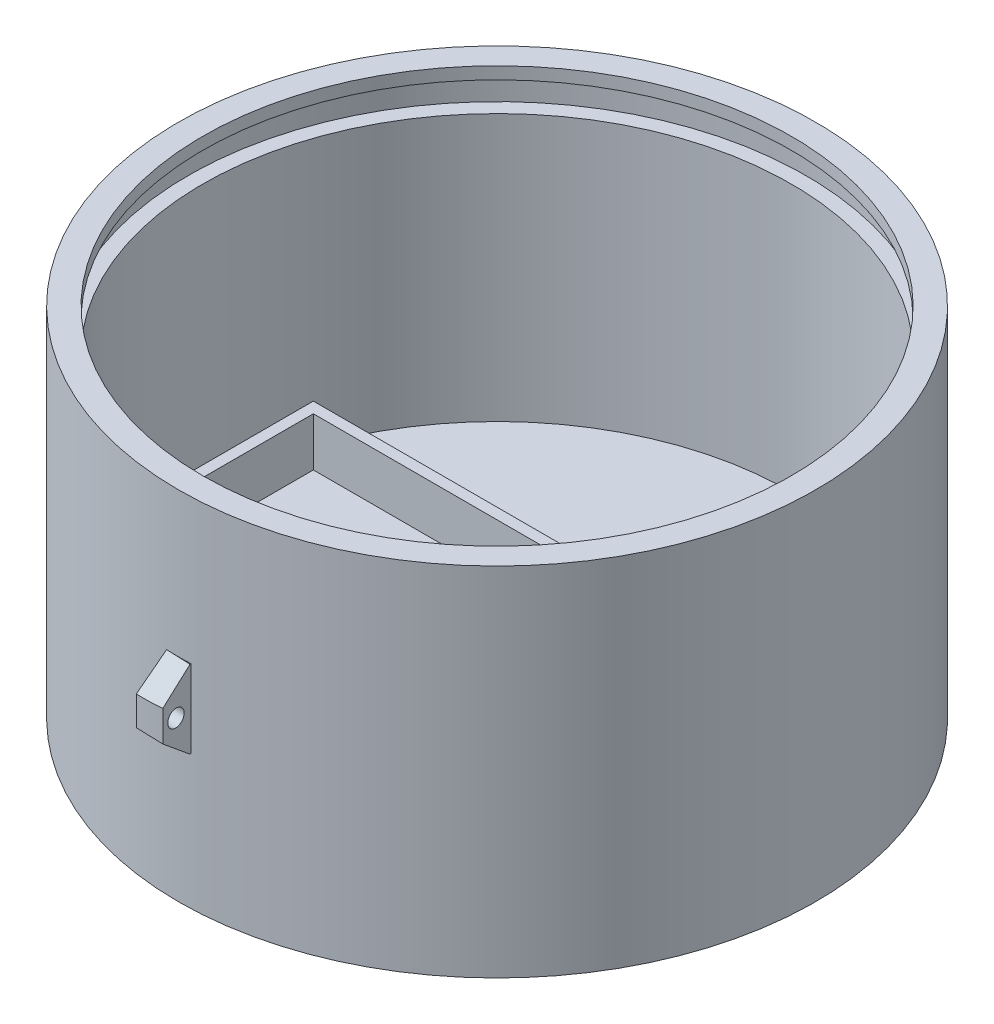
from build123d import *

# Parameters (mm, degrees)
WRAP1_SECTION_W          = 6
WRAP1_SECTION_H          = 16
WRAP1_ANGLE              = 4.377064898
WRAP2_START              = 27.6
WRAP2_DEPTH              = 16
SKETCH12_R               = 1.75
CUT_EXTRUDE3_DEPTH       = 122.497716028
SKETCH14_R               = 1.75
CUT_EXTRUDE4_DEPTH       = 122.497716028
CUT_EXTRUDE8_DEPTH       = 122.497716028
CUT_EXTRUDE8_DEPTH_BACK  = 7
CUT_EXTRUDE9_START       = -5.453057477
CUT_EXTRUDE9_DEPTH       = 5.453057477
CUT_EXTRUDE10_DEPTH      = 122.497716028
CUT_EXTRUDE10_DEPTH_BACK = 7
CUT_EXTRUDE11_START      = -5.453057477
CUT_EXTRUDE11_DEPTH      = 5.453057477
SKETCH4_W                = 71
SKETCH4_H                = 35
SKETCH4_W_2              = 66
SKETCH4_H_2              = 30.5
BOSS_EXTRUDE1_DEPTH      = 10
SKETCH20_R               = 9
CUT_EXTRUDE13_DEPTH      = 8
FILLET2_R                = 1
SKETCH21_W               = 0.673076924
SKETCH21_H               = 3.5
BOSS_EXTRUDE2_DEPTH      = 3


# Read off the part's stored shape, not the designer's step: Wrap2, Cut-Extrude9, Cut-Extrude11
with BuildPart() as part:
    # Sketch2 → Revolve1 (revolve)
    with BuildSketch(Plane(origin=(0, 0, 0), x_dir=(0, 0, -1), z_dir=(1, 0, 0))):
        Polygon((0, 0), (-65.45, 0), (-65.45, 73.3), (-60.45, 73.3), (-60.45, 70.8), (-63.45, 70.8), (-63.45, 64.8), (-60.45, 64.8), (-60.45, 10), (0, 10), align=None)
    revolve(axis=Axis((0, 10, 0), (0, -1, 0)))

    # Wrap1 section (on wrap section) → Wrap1 (revolve)
    with BuildSketch(Plane(origin=(0, 0, 0), x_dir=(-0.038187809321442584, 0, 0.9992705795825418), z_dir=(-0.9992705795825418, 0, -0.038187809321442584))):
        with Locations((68.45, 35.6)):
            Rectangle(WRAP1_SECTION_W, WRAP1_SECTION_H)
    revolve(axis=Axis((0, 0, 0), (0, 1, 0)), revolution_arc=WRAP1_ANGLE)

    # Wrap2 outline → Wrap2 (add)
    with BuildSketch(Plane(origin=(0, 0, 0), x_dir=(1, 0, 0), z_dir=(0, 1, 0)).offset(WRAP2_START)):
        with BuildLine():
            Line((2.49939212, 65.402259434), (2.728518976, 71.397882911))
            ThreePointArc((2.728518976, 71.397882911), (0, 71.45), (-2.728518976, 71.397882911))
            Line((-2.728518976, 71.397882911), (-2.49939212, 65.402259434))
            ThreePointArc((-2.49939212, 65.402259434), (0, 65.45), (2.49939212, 65.402259434))
        make_face()
    extrude(amount=WRAP2_DEPTH)

    # Sketch12 → Cut-Extrude3 (cut, through all)
    with BuildSketch(Plane(origin=(0, 0, 0), x_dir=(0.038187809321442286, 0, 0.9992705795825418), z_dir=(-0.999270579582542, 0, 0.038187809321442286))):
        with Locations((-68.45, 35.6)):
            Circle(SKETCH12_R)
    extrude(amount=-CUT_EXTRUDE3_DEPTH, mode=Mode.SUBTRACT)

    # Sketch14 → Cut-Extrude4 (cut, through all)
    with BuildSketch(Plane(origin=(0, 0, 0), x_dir=(-0.038187809321442896, 0, 0.999270579582542), z_dir=(-0.999270579582542, 0, -0.038187809321442896))):
        with Locations((68.45, 35.6)):
            Circle(SKETCH14_R)
    extrude(amount=-CUT_EXTRUDE4_DEPTH, mode=Mode.SUBTRACT)

    # Sketch16 → Cut-Extrude8 (cut, two sides: drawn at the far end of the back side and taken through both)
    with BuildSketch(Plane(origin=(0, 0, 0), x_dir=(0.038187809321442286, 0, 0.9992705795825418), z_dir=(-0.999270579582542, 0, 0.038187809321442286)).offset(-CUT_EXTRUDE8_DEPTH_BACK)):
        Polygon((-71.45, 27.6), (-65.45, 27.6), (-71.45, 32.6), align=None)
    extrude(amount=CUT_EXTRUDE8_DEPTH + CUT_EXTRUDE8_DEPTH_BACK, mode=Mode.SUBTRACT)

    # Cut-Extrude9 outline → Cut-Extrude9 (cut)
    with BuildSketch(Plane(origin=(0, 0, 0), x_dir=(0.038187809321442286, 0, 0.9992705795825418), z_dir=(-0.999270579582542, 0, 0.038187809321442286)).offset(CUT_EXTRUDE9_START)):
        Polygon((-73, 37.308333333), (-71.45, 38.6), (-65.45, 43.6), (-73, 43.6), align=None)
    extrude(amount=CUT_EXTRUDE9_DEPTH, mode=Mode.SUBTRACT)

    # Sketch18 → Cut-Extrude10 (cut, two sides: drawn at the far end of the back side and taken through both)
    with BuildSketch(Plane(origin=(0, 0, 0), x_dir=(-0.038187809321442896, 0, 0.999270579582542), z_dir=(-0.999270579582542, 0, -0.038187809321442896)).offset(-CUT_EXTRUDE10_DEPTH_BACK)):
        Polygon((71.45, 43.6), (65.45, 43.6), (71.45, 38.6), align=None)
    extrude(amount=CUT_EXTRUDE10_DEPTH + CUT_EXTRUDE10_DEPTH_BACK, mode=Mode.SUBTRACT)

    # Cut-Extrude11 outline → Cut-Extrude11 (cut)
    with BuildSketch(Plane(origin=(0, 0, 0), x_dir=(-0.038187809321442896, 0, 0.999270579582542), z_dir=(-0.999270579582542, 0, -0.038187809321442896)).offset(CUT_EXTRUDE11_START)):
        Polygon((73, 33.891666667), (71.45, 32.6), (65.45, 27.6), (73, 27.6), align=None)
    extrude(amount=CUT_EXTRUDE11_DEPTH, mode=Mode.SUBTRACT)

    # Sketch4 → Boss-Extrude1 (add)
    with BuildSketch(Plane(origin=(0, 10, 0), x_dir=(1, 0, 0), z_dir=(0, 1, 0))):
        with Locations((-19.751670263, 0)):
            Rectangle(SKETCH4_W, SKETCH4_H)
        with Locations((-20, 0)):
            Rectangle(SKETCH4_W_2, SKETCH4_H_2, mode=Mode.SUBTRACT)
    extrude(amount=BOSS_EXTRUDE1_DEPTH)

    # Sketch20 → Cut-Extrude13 (cut)
    with BuildSketch(Plane(origin=(0, 10, 0), x_dir=(1, 0, 0), z_dir=(0, 1, 0))):
        with Locations(Location((0, 0, 0), (0, 0, 270))):
            Circle(SKETCH20_R)
    extrude(amount=-CUT_EXTRUDE13_DEPTH, mode=Mode.SUBTRACT)

    # Fillet2
    fillet2_edges = [part.edges().sort_by_distance(p)[0] for p in [
        (15.748329737, 10, 0),
        (-19.751670263, 10, -17.5),
        (-55.251670263, 10, 0),
        (-19.751670263, 10, 17.5),
    ]]
    fillet(fillet2_edges, radius=FILLET2_R)

    # Sketch21 → Boss-Extrude2 (add)
    # profile 1 of 6: a face of its own
    with BuildSketch(Plane(origin=(0, 10, 0), x_dir=(1, 0, 0), z_dir=(0, 1, 0))):
        with BuildLine():
            Line((-12.141025641, -36.5), (-10.857271635, -36.5))
            add(Edge.make_bspline(
                [(-10.857271635, -36.5), (-10.822210229, -36.499981824), (-10.753937526, -36.49994643), (-10.654855962, -36.504056876), (-10.56220196, -36.508191444), (-10.476241462, -36.516467945), (-10.396676244, -36.525143185), (-10.323363529, -36.536126692), (-10.256766437, -36.550203259), (-10.214770349, -36.561304315), (-10.194711538, -36.566606571)],
                knots=[0, 0, 0, 0, 1.259756885, 2.453039283, 3.563158368, 4.591894114, 5.55549294, 6.43918076, 7.254497783, 8, 8, 8, 8], degree=3))
            add(Edge.make_bspline(
                [(-10.194711538, -36.566606571), (-10.169626771, -36.574782088), (-10.119909071, -36.590985862), (-10.047021394, -36.619377572), (-9.977964115, -36.654589018), (-9.910175291, -36.691602799), (-9.846681209, -36.73536729), (-9.784121638, -36.780898384), (-9.726556593, -36.833641393), (-9.65106744, -36.907353221), (-9.564928578, -37.01003613), (-9.474684994, -37.146239848), (-9.398302781, -37.295742168), (-9.346114942, -37.429691041), (-9.310875687, -37.543558898), (-9.28784017, -37.634852046), (-9.2682729, -37.731017734), (-9.25220811, -37.832080205), (-9.239726231, -37.938039474), (-9.23043334, -38.048867296), (-9.225906764, -38.164659414), (-9.224881873, -38.243453285), (-9.224358974, -38.283653846)],
                knots=[0, 0, 0, 0, 0.745524535, 1.477620414, 2.207090574, 2.934465325, 3.657932502, 4.384347339, 5.118673636, 5.861150177, 7.365375624, 8.894729774, 10.468936425, 12.099947606, 12.950091786, 13.83580991, 14.759228729, 15.722225242, 16.726454549, 17.773376212, 18.863978586, 20, 20, 20, 20], degree=3))
            add(Edge.make_bspline(
                [(-9.224358974, -38.283653846), (-9.225313504, -38.353132754), (-9.227159546, -38.487503567), (-9.248546056, -38.68140009), (-9.27936672, -38.861494775), (-9.314108, -38.973845669), (-9.330929487, -39.028245192)],
                knots=[0, 0, 0, 0, 1.103207939, 2.133582005, 3.096293362, 4, 4, 4, 4], degree=3))
            add(Edge.make_bspline(
                [(-9.330929487, -39.028245192), (-9.342037242, -39.059460825), (-9.363887929, -39.120866843), (-9.402124993, -39.209445326), (-9.44344041, -39.293740854), (-9.488176876, -39.373687012), (-9.536560412, -39.4489242), (-9.58877199, -39.519227379), (-9.644002289, -39.585522113), (-9.684013445, -39.626326835), (-9.703926282, -39.646634615)],
                knots=[0, 0, 0, 0, 1.090884612, 2.145940218, 3.175104604, 4.181306866, 5.161203701, 6.118658341, 7.063689906, 8, 8, 8, 8], degree=3))
            add(Edge.make_bspline(
                [(-9.703926282, -39.646634615), (-9.736150063, -39.675613715), (-9.802600093, -39.735372749), (-9.919696425, -39.809326942), (-10.052048208, -39.8746749), (-10.147783396, -39.908243061), (-10.197516026, -39.92568109)],
                knots=[0, 0, 0, 0, 0.908140292, 1.872714733, 2.8949153, 4, 4, 4, 4], degree=3))
            add(Edge.make_bspline(
                [(-10.197516026, -39.92568109), (-10.217535933, -39.9318298), (-10.259086215, -39.944591129), (-10.324968285, -39.958220492), (-10.395299047, -39.972579161), (-10.470889512, -39.981229045), (-10.550955016, -39.99035073), (-10.636133606, -39.995472046), (-10.726130013, -39.999107884), (-10.787856342, -39.999698219), (-10.819411058, -40)],
                knots=[0, 0, 0, 0, 0.799129865, 1.658552685, 2.566799617, 3.538529252, 4.561352959, 5.643373779, 6.795284424, 8, 8, 8, 8], degree=3))
            Line((-10.819411058, -40), (-12.141025641, -40))
            Line((-12.141025641, -40), (-12.141025641, -36.5))
        make_face()
        with BuildLine():
            Line((-11.467948718, -37.083333333), (-11.467948718, -39.416666667))
            Line((-11.467948718, -39.416666667), (-10.9140625, -39.416666667))
            add(Edge.make_bspline(
                [(-10.9140625, -39.416666667), (-10.889055989, -39.416468348), (-10.840908903, -39.416086509), (-10.771238837, -39.41496452), (-10.707212632, -39.411927085), (-10.64849488, -39.408780797), (-10.595238446, -39.403582578), (-10.547211603, -39.398469932), (-10.504681692, -39.391317447), (-10.478414174, -39.38567137), (-10.466045673, -39.383012821)],
                knots=[0, 0, 0, 0, 1.333384787, 2.567275092, 3.714769766, 4.750907381, 5.701951617, 6.567520054, 7.325492842, 8, 8, 8, 8], degree=3))
            add(Edge.make_bspline(
                [(-10.466045673, -39.383012821), (-10.437077242, -39.375282606), (-10.380654381, -39.360226188), (-10.301430978, -39.326661097), (-10.229744006, -39.286168488), (-10.164392926, -39.237477866), (-10.105498076, -39.175944181), (-10.055224121, -39.097247424), (-10.008696902, -39.003390439), (-9.976835051, -38.913545831), (-9.953964675, -38.833298729), (-9.938483307, -38.765945356), (-9.926248801, -38.693075817), (-9.915725529, -38.614977702), (-9.907222476, -38.531751441), (-9.901931473, -38.44309649), (-9.898320332, -38.349121373), (-9.897736294, -38.284592346), (-9.897435897, -38.251402244)],
                knots=[0, 0, 0, 0, 1.038686998, 2.023088296, 2.974059649, 3.888265163, 4.839857954, 5.909819677, 7.113156087, 8.466843969, 9.20827164, 10.006482943, 10.861893492, 11.769681931, 12.739021491, 13.762258324, 14.849031541, 16, 16, 16, 16], degree=3))
            add(Edge.make_bspline(
                [(-9.897435897, -38.251402244), (-9.897733984, -38.218212039), (-9.898311433, -38.153916361), (-9.901917036, -38.060641966), (-9.907178318, -37.973383084), (-9.915741927, -37.89203185), (-9.926102071, -37.81647583), (-9.938479884, -37.746651087), (-9.953867928, -37.683015858), (-9.976757756, -37.607416031), (-10.011457557, -37.522439478), (-10.058677214, -37.42953071), (-10.116664578, -37.350341951), (-10.180734969, -37.281549381), (-10.254609212, -37.224936572), (-10.33638782, -37.177520048), (-10.427851348, -37.140717204), (-10.492912229, -37.125041666), (-10.526342147, -37.116987179)],
                knots=[0, 0, 0, 0, 1.117996097, 2.165769068, 3.143980016, 4.062055362, 4.920439205, 5.712587309, 6.449616741, 7.124491204, 8.371470382, 9.537068822, 10.625202851, 11.666538334, 12.693249444, 13.747832046, 14.842779399, 16, 16, 16, 16], degree=3))
            add(Edge.make_bspline(
                [(-10.526342147, -37.116987179), (-10.540812245, -37.114298433), (-10.572669861, -37.108378842), (-10.625534508, -37.101464725), (-10.687556519, -37.09633386), (-10.75905207, -37.091095697), (-10.839731668, -37.088105918), (-10.929932897, -37.084985599), (-11.029278307, -37.083919703), (-11.098691488, -37.083534407), (-11.134915865, -37.083333333)],
                knots=[0, 0, 0, 0, 0.578738571, 1.274160813, 2.095454135, 3.025967819, 4.093109015, 5.270126069, 6.575371698, 8, 8, 8, 8], degree=3))
            Line((-11.134915865, -37.083333333), (-11.467948718, -37.083333333))
        make_face(mode=Mode.SUBTRACT)
    # profile 2 of 6: a face of its own
    with BuildSketch(Plane(origin=(0, 10, 0), x_dir=(1, 0, 0), z_dir=(0, 1, 0))):
        with Locations((-6.733974359, -38.25)):
            Rectangle(SKETCH21_W, SKETCH21_H)
    # profile 3 of 6: a face of its own
    with BuildSketch(Plane(origin=(0, 10, 0), x_dir=(1, 0, 0), z_dir=(0, 1, 0))):
        Polygon((-4.064102564, -40), (-4.064102564, -36.5), (-3.360877404, -36.5), (-1.955128205, -38.801081731), (-1.955128205, -36.5), (-1.282051282, -36.5), (-1.282051282, -40), (-2.007011218, -40), (-3.391025641, -37.735376603), (-3.391025641, -40), align=None)
    # profile 4 of 6: a face of its own
    with BuildSketch(Plane(origin=(0, 10, 0), x_dir=(1, 0, 0), z_dir=(0, 1, 0))):
        with BuildLine():
            Line((2.621794872, -38.698717949), (2.621794872, -38.115384615))
            Line((2.621794872, -38.115384615), (4.147435897, -38.115384615))
            Line((4.147435897, -38.115384615), (4.147435897, -39.521834936))
            add(Edge.make_bspline(
                [(4.147435897, -39.521834936), (4.128234843, -39.53912502), (4.088984003, -39.57446945), (4.024941828, -39.624313939), (3.954437426, -39.671900407), (3.877897011, -39.7181926), (3.795162182, -39.762817935), (3.70656293, -39.806397929), (3.611935785, -39.848506383), (3.478119167, -39.901255832), (3.305869748, -39.958651592), (3.09529139, -40.008559069), (2.88304722, -40.039169295), (2.741084391, -40.042972199), (2.670172276, -40.044871795)],
                knots=[0, 0, 0, 0, 0.581799769, 1.189316438, 1.825828404, 2.496525428, 3.203088405, 3.942228803, 4.719818701, 5.534979611, 7.181138583, 8.803804008, 10.403462225, 12, 12, 12, 12], degree=3))
            add(Edge.make_bspline(
                [(2.670172276, -40.044871795), (2.625748151, -40.044204229), (2.538174989, -40.042888259), (2.408897047, -40.032296077), (2.284091519, -40.014172903), (2.163656696, -39.988509619), (2.047184917, -39.957573108), (1.935161675, -39.918108801), (1.827984689, -39.870735053), (1.724682932, -39.817946794), (1.627182199, -39.757315181), (1.5353883, -39.690989608), (1.449965624, -39.618393164), (1.37122041, -39.539379517), (1.298098141, -39.454492848), (1.231451989, -39.363328366), (1.171684988, -39.265780824), (1.118059397, -39.16307385), (1.070351861, -39.056110721), (1.03009506, -38.945733293), (0.994801855, -38.833544125), (0.965794698, -38.719149346), (0.944490359, -38.60217704), (0.927928803, -38.48316843), (0.91903364, -38.361379944), (0.917461016, -38.279459688), (0.916666667, -38.238080929)],
                knots=[0, 0, 0, 0, 1.124918047, 2.217548049, 3.282233239, 4.316494221, 5.334437038, 6.332151046, 7.320712088, 8.300141923, 9.267552434, 10.225301062, 11.165776911, 12.103230934, 13.047553934, 14.000517593, 14.959782875, 15.941944936, 16.932894943, 17.923491392, 18.915624898, 19.910402922, 20.909870877, 21.92519501, 22.95199481, 24, 24, 24, 24], degree=3))
            add(Edge.make_bspline(
                [(0.916666667, -38.238080929), (0.917310874, -38.193420086), (0.918580884, -38.105374262), (0.929526594, -37.975243558), (0.946523987, -37.848926166), (0.972299421, -37.726651409), (1.003657833, -37.607850107), (1.041928993, -37.492600496), (1.08881961, -37.381756462), (1.140981157, -37.274370045), (1.200360102, -37.171926289), (1.26745497, -37.075739203), (1.340280242, -36.984838634), (1.420275003, -36.900668462), (1.50715755, -36.8232697), (1.600044679, -36.751786373), (1.698713945, -36.684986195), (1.769334205, -36.647321112), (1.804987981, -36.628305288)],
                knots=[0, 0, 0, 0, 1.105010302, 2.178452875, 3.229459892, 4.257086284, 5.268538906, 6.268935615, 7.259234261, 8.24469117, 9.221745683, 10.185929258, 11.144249683, 12.101504986, 13.055838221, 14.020611351, 15.000673771, 16, 16, 16, 16], degree=3))
            add(Edge.make_bspline(
                [(1.804987981, -36.628305288), (1.833282927, -36.614255794), (1.890752285, -36.585720119), (1.982186273, -36.551650528), (2.077813561, -36.520650509), (2.179077914, -36.497520693), (2.285291665, -36.478517763), (2.396407744, -36.464336585), (2.512783625, -36.456889502), (2.591870737, -36.45572412), (2.632311699, -36.455128205)],
                knots=[0, 0, 0, 0, 0.887969848, 1.803539625, 2.741143579, 3.713741423, 4.722068772, 5.775476617, 6.8624965, 8, 8, 8, 8], degree=3))
            add(Edge.make_bspline(
                [(2.632311699, -36.455128205), (2.684452949, -36.455904854), (2.785858039, -36.457415292), (2.933699068, -36.470001131), (3.072836796, -36.491692409), (3.203464983, -36.521567203), (3.325302214, -36.559978258), (3.438138749, -36.607200011), (3.542667152, -36.662282139), (3.637373457, -36.727432178), (3.724182442, -36.79926772), (3.802867581, -36.877876145), (3.873460546, -36.963373886), (3.936008039, -37.055330742), (3.99001777, -37.154126811), (4.036455823, -37.258861049), (4.074679963, -37.370328564), (4.093152842, -37.447740779), (4.102564103, -37.487179487)],
                knots=[0, 0, 0, 0, 1.271135529, 2.472123572, 3.614091059, 4.701890498, 5.736279567, 6.724681829, 7.680621489, 8.611506429, 9.52200816, 10.424540711, 11.318996785, 12.221421405, 13.131851814, 14.060431888, 15.011860567, 16, 16, 16, 16], degree=3))
            Line((4.102564103, -37.487179487), (3.429487179, -37.621794872))
            add(Edge.make_bspline(
                [(3.429487179, -37.621794872), (3.422822441, -37.599708128), (3.409673035, -37.556131394), (3.384182051, -37.493579866), (3.354822034, -37.434777293), (3.321522559, -37.379298054), (3.283948158, -37.327483706), (3.241191037, -37.279893171), (3.195940874, -37.234355653), (3.14524241, -37.19404077), (3.091201898, -37.157697087), (3.034428261, -37.124924487), (2.973638655, -37.098346822), (2.909684587, -37.0769622), (2.842878639, -37.058801012), (2.772348966, -37.047631812), (2.698887604, -37.039208077), (2.648697516, -37.03871305), (2.623197115, -37.038461538)],
                knots=[0, 0, 0, 0, 1.027736275, 2.027704492, 3.005900071, 3.954421694, 4.908588141, 5.853155543, 6.803277083, 7.766271258, 8.734041521, 9.704274878, 10.683578894, 11.68490234, 12.708089448, 13.76461009, 14.864251086, 16, 16, 16, 16], degree=3))
            add(Edge.make_bspline(
                [(2.623197115, -37.038461538), (2.584601366, -37.039491286), (2.509278473, -37.041500925), (2.399317088, -37.054614254), (2.295578608, -37.07794407), (2.197791765, -37.110123102), (2.105777287, -37.151427144), (2.020778573, -37.203396748), (1.940679209, -37.262956796), (1.86775854, -37.332860046), (1.801627779, -37.411241564), (1.744379775, -37.499036273), (1.696721058, -37.595960384), (1.657685852, -37.701527212), (1.626605499, -37.81574116), (1.605520981, -37.939006546), (1.59174474, -38.071134269), (1.59042433, -38.162322619), (1.58974359, -38.209334936)],
                knots=[0, 0, 0, 0, 1.043810997, 2.037086103, 2.989314757, 3.91471467, 4.817033861, 5.710208705, 6.603920097, 7.511448416, 8.435617211, 9.371747005, 10.338444094, 11.350425613, 12.411431869, 13.5347293, 14.729025275, 16, 16, 16, 16], degree=3))
            add(Edge.make_bspline(
                [(1.58974359, -38.209334936), (1.590453463, -38.259846408), (1.591833143, -38.358018404), (1.605248277, -38.50026328), (1.62731629, -38.632790193), (1.658969063, -38.75543198), (1.698798108, -38.868623755), (1.746674402, -38.972727115), (1.805759534, -39.065810305), (1.872313885, -39.149739152), (1.946701341, -39.223075654), (2.026835933, -39.287012416), (2.112271517, -39.341196503), (2.203795939, -39.384772636), (2.300254868, -39.41946036), (2.402535085, -39.443778863), (2.510332044, -39.458884621), (2.584117061, -39.460641383), (2.621794872, -39.461538462)],
                knots=[0, 0, 0, 0, 1.318042826, 2.561693173, 3.724929596, 4.821196409, 5.862977565, 6.853497791, 7.804600806, 8.73339865, 9.643480846, 10.524649628, 11.404635349, 12.277659519, 13.165160235, 14.075017549, 15.017020959, 16, 16, 16, 16], degree=3))
            add(Edge.make_bspline(
                [(2.621794872, -39.461538462), (2.659956895, -39.460477677), (2.736646014, -39.45834596), (2.851512074, -39.440281814), (2.966827559, -39.413699843), (3.07988614, -39.373600446), (3.189685033, -39.327606719), (3.292194026, -39.274599762), (3.388190539, -39.219346956), (3.445991623, -39.176282979), (3.474358974, -39.155148237)],
                knots=[0, 0, 0, 0, 0.993821502, 1.997150276, 3.023717651, 4.073291794, 5.118404464, 6.123376694, 7.078999408, 8, 8, 8, 8], degree=3))
            Line((3.474358974, -39.155148237), (3.474358974, -38.698717949))
            Line((3.474358974, -38.698717949), (2.621794872, -38.698717949))
        make_face()
    # profile 5 of 6: a face of its own
    with BuildSketch(Plane(origin=(0, 10, 0), x_dir=(1, 0, 0), z_dir=(0, 1, 0))):
        with BuildLine():
            Line((6.435897436, -36.5), (7.108974359, -36.5))
            Line((7.108974359, -36.5), (7.108974359, -38.399338942))
            add(Edge.make_bspline(
                [(7.108974359, -38.399338942), (7.109231315, -38.435329821), (7.109721868, -38.504039826), (7.110059543, -38.602205261), (7.111928279, -38.690342638), (7.115980816, -38.768593978), (7.118762184, -38.836919373), (7.123926882, -38.895331365), (7.129079064, -38.943807204), (7.134088222, -38.972641034), (7.136318109, -38.985476763)],
                knots=[0, 0, 0, 0, 1.470600056, 2.807515117, 4.011048972, 5.072079398, 6.00911328, 6.804506435, 7.467811572, 8, 8, 8, 8], degree=3))
            add(Edge.make_bspline(
                [(7.136318109, -38.985476763), (7.145511381, -39.020080011), (7.163614095, -39.088218175), (7.21351183, -39.181361236), (7.279426034, -39.263460979), (7.346660953, -39.322011311), (7.407480116, -39.363448892), (7.459141011, -39.388668401), (7.513952884, -39.411657605), (7.573074486, -39.429297027), (7.635871289, -39.444732155), (7.703101811, -39.453656855), (7.774198667, -39.46050634), (7.822931034, -39.461188268), (7.847956731, -39.461538462)],
                knots=[0, 0, 0, 0, 1.376921055, 2.711331395, 4.038631339, 5.418057255, 6.132954575, 6.870556231, 7.630397752, 8.422890386, 9.247036838, 10.121396817, 11.035274583, 12, 12, 12, 12], degree=3))
            add(Edge.make_bspline(
                [(7.847956731, -39.461538462), (7.873204923, -39.461080538), (7.922362636, -39.460188971), (7.993600556, -39.454879377), (8.060064317, -39.444862004), (8.121713261, -39.431727293), (8.178872996, -39.415127219), (8.23108751, -39.394109575), (8.278274522, -39.368816745), (8.33371855, -39.330694201), (8.393376251, -39.276915698), (8.450789172, -39.203796952), (8.49187915, -39.123081812), (8.511152091, -39.049382851), (8.521057736, -38.985171209), (8.527092787, -38.928983793), (8.532612147, -38.865399134), (8.537624148, -38.794591389), (8.541051713, -38.71650741), (8.542905624, -38.630949715), (8.544364661, -38.537931951), (8.544698721, -38.473424775), (8.544871795, -38.440004006)],
                knots=[0, 0, 0, 0, 1.036876239, 2.018776863, 2.930845756, 3.794842666, 4.605604932, 5.371924355, 6.101864688, 6.799283669, 8.1310906, 9.382718023, 10.597336334, 11.822035891, 12.492591141, 13.265194674, 14.141890321, 15.11351293, 16.179860579, 17.351049011, 18.627594861, 20, 20, 20, 20], degree=3))
            Line((8.544871795, -38.440004006), (8.544871795, -36.5))
            Line((8.544871795, -36.5), (9.217948718, -36.5))
            Line((9.217948718, -36.5), (9.217948718, -38.330629006))
            add(Edge.make_bspline(
                [(9.217948718, -38.330629006), (9.217862448, -38.381110281), (9.217696684, -38.478108663), (9.215108497, -38.617665133), (9.20960778, -38.745702344), (9.205001404, -38.862439771), (9.196115894, -38.967579604), (9.186812795, -39.061187215), (9.174828285, -39.143246245), (9.157738263, -39.236518257), (9.12901737, -39.341163454), (9.082729165, -39.456757495), (9.023571447, -39.561923328), (8.951779949, -39.657064464), (8.867768246, -39.742559044), (8.770278442, -39.81807096), (8.66031302, -39.884518224), (8.559542411, -39.932364407), (8.47168335, -39.964582459), (8.400123614, -39.986386192), (8.323538288, -40.004544141), (8.242017194, -40.018954088), (8.155525302, -40.031103805), (8.064031209, -40.039217825), (7.967673337, -40.044281546), (7.901949819, -40.044671883), (7.868289263, -40.044871795)],
                knots=[0, 0, 0, 0, 1.415574045, 2.719986624, 3.913607924, 5.00929969, 5.995467356, 6.871900228, 7.64671288, 8.320227872, 9.530145585, 10.682614022, 11.803571353, 12.90325401, 14.015460715, 15.154679255, 16.351678057, 17.612271512, 18.275764165, 18.974412946, 19.708786676, 20.481351116, 21.295095879, 22.157200529, 23.056203067, 24, 24, 24, 24], degree=3))
            add(Edge.make_bspline(
                [(7.868289263, -40.044871795), (7.827855073, -40.044354941), (7.749528019, -40.043353718), (7.635829788, -40.038887346), (7.529891971, -40.029668586), (7.43138173, -40.017208567), (7.340339739, -40.001190806), (7.256535682, -39.982041673), (7.180638613, -39.957839871), (7.090239112, -39.923273846), (6.989473789, -39.870399415), (6.879786472, -39.799865355), (6.78349987, -39.720255145), (6.701460007, -39.632346677), (6.632877874, -39.539229253), (6.577132717, -39.442917831), (6.532460383, -39.345017706), (6.513793746, -39.276975203), (6.504607372, -39.243489583)],
                knots=[0, 0, 0, 0, 1.128613534, 2.186292659, 3.174878439, 4.095586888, 4.95671962, 5.754129884, 6.492676435, 7.178284149, 8.453103036, 9.659838108, 10.813193309, 11.929983019, 13.007587775, 14.033493319, 15.032227051, 16, 16, 16, 16], degree=3))
            add(Edge.make_bspline(
                [(6.504607372, -39.243489583), (6.498984987, -39.217126725), (6.487142447, -39.161598115), (6.473692609, -39.073318511), (6.461422393, -38.976107882), (6.453041676, -38.869851243), (6.445097524, -38.754885729), (6.439393903, -38.63099457), (6.437048569, -38.498205899), (6.436288877, -38.406584249), (6.435897436, -38.359375)],
                knots=[0, 0, 0, 0, 0.728071598, 1.533551606, 2.411422299, 3.374601532, 4.412367648, 5.524718474, 6.72457895, 8, 8, 8, 8], degree=3))
            Line((6.435897436, -38.359375), (6.435897436, -36.5))
        make_face()
    # profile 6 of 6: a face of its own
    with BuildSketch(Plane(origin=(0, 10, 0), x_dir=(1, 0, 0), z_dir=(0, 1, 0))):
        with BuildLine():
            Line((11.371794872, -38.833333333), (12.044871795, -38.788461538))
            add(Edge.make_bspline(
                [(12.044871795, -38.788461538), (12.050234008, -38.816620707), (12.060649766, -38.8713181), (12.083791626, -38.949269353), (12.109264408, -39.021942028), (12.139705778, -39.088556834), (12.173031303, -39.150345107), (12.211978688, -39.205546649), (12.253830863, -39.255923904), (12.300659592, -39.299667535), (12.351678884, -39.337978812), (12.407143322, -39.370651946), (12.466451899, -39.398931133), (12.529749632, -39.422218147), (12.597688901, -39.439602017), (12.669677857, -39.451969609), (12.745819743, -39.459889474), (12.797856658, -39.460979802), (12.824519231, -39.461538462)],
                knots=[0, 0, 0, 0, 1.204560339, 2.339781841, 3.415289417, 4.440034832, 5.416475564, 6.362424008, 7.275913008, 8.16578645, 9.05021719, 9.95355393, 10.867835453, 11.809845306, 12.784702352, 13.812224031, 14.87903166, 16, 16, 16, 16], degree=3))
            add(Edge.make_bspline(
                [(12.824519231, -39.461538462), (12.852583275, -39.461232285), (12.907169286, -39.460636755), (12.986270451, -39.453248682), (13.060233633, -39.442664474), (13.128405712, -39.42590992), (13.192059736, -39.407172603), (13.249614803, -39.381537957), (13.302002292, -39.351972098), (13.34908724, -39.318422509), (13.390178319, -39.281213607), (13.426126845, -39.242368721), (13.457435637, -39.202727078), (13.482077871, -39.160529555), (13.502020501, -39.117482795), (13.515201183, -39.072302639), (13.524105514, -39.02602652), (13.525126582, -38.994399947), (13.525641026, -38.978465545)],
                knots=[0, 0, 0, 0, 1.417779877, 2.757654889, 4.012140507, 5.189587551, 6.302846416, 7.360586765, 8.365575446, 9.33904572, 10.275781718, 11.161696098, 12.012180333, 12.822428111, 13.625933072, 14.403138519, 15.195454004, 16, 16, 16, 16], degree=3))
            add(Edge.make_bspline(
                [(13.525641026, -38.978465545), (13.525010104, -38.958501032), (13.523775798, -38.919443383), (13.508915991, -38.863606197), (13.486631317, -38.811874657), (13.453078298, -38.765012839), (13.407974783, -38.722187967), (13.350440754, -38.682126347), (13.27887024, -38.646086557), (13.225774228, -38.625983496), (13.197516026, -38.615284455)],
                knots=[0, 0, 0, 0, 0.90494901, 1.770400303, 2.607161909, 3.452839393, 4.36912122, 5.420987164, 6.627424851, 8, 8, 8, 8], degree=3))
            add(Edge.make_bspline(
                [(13.197516026, -38.615284455), (13.185391179, -38.611221363), (13.158257742, -38.602128823), (13.11197098, -38.589127349), (13.056217344, -38.572891961), (12.990191161, -38.554437851), (12.913914631, -38.535564155), (12.828239663, -38.512313903), (12.732121784, -38.489178001), (12.664877601, -38.472099084), (12.629607372, -38.463141026)],
                knots=[0, 0, 0, 0, 0.521821638, 1.167752076, 1.961721917, 2.891982557, 3.96540661, 5.168436773, 6.514817513, 8, 8, 8, 8], degree=3))
            add(Edge.make_bspline(
                [(12.629607372, -38.463141026), (12.583675066, -38.451672801), (12.495056192, -38.429546736), (12.368665385, -38.390186035), (12.252257141, -38.351078999), (12.146952282, -38.308645767), (12.051589251, -38.265762152), (11.967710575, -38.219417441), (11.893565889, -38.17201848), (11.85036006, -38.136591338), (11.829627404, -38.119591346)],
                knots=[0, 0, 0, 0, 1.293880989, 2.496331788, 3.617634808, 4.64976062, 5.598842568, 6.473791081, 7.267636666, 8, 8, 8, 8], degree=3))
            add(Edge.make_bspline(
                [(11.829627404, -38.119591346), (11.803916215, -38.095518071), (11.753507051, -38.048320188), (11.687151212, -37.970765008), (11.631394238, -37.888840369), (11.585500144, -37.803150984), (11.550162559, -37.713203543), (11.525115734, -37.619600116), (11.508904519, -37.52209641), (11.507250276, -37.455694076), (11.506410256, -37.42197516)],
                knots=[0, 0, 0, 0, 1.064429417, 2.086912298, 3.078678339, 4.055528992, 5.020032834, 5.993708893, 6.981211098, 8, 8, 8, 8], degree=3))
            add(Edge.make_bspline(
                [(11.506410256, -37.42197516), (11.508046202, -37.378343285), (11.511291429, -37.29179067), (11.541052275, -37.16457014), (11.587411543, -37.041812127), (11.6411773, -36.944337719), (11.692834593, -36.870597961), (11.735732214, -36.817682985), (11.782859395, -36.768159655), (11.834861678, -36.723236001), (11.88980809, -36.680280587), (11.949827467, -36.642135665), (12.013218077, -36.606205259), (12.104951512, -36.563611434), (12.229500345, -36.519224485), (12.391545069, -36.481809103), (12.567979684, -36.459317627), (12.690302347, -36.456558398), (12.753705929, -36.455128205)],
                knots=[0, 0, 0, 0, 1.180131776, 2.341029169, 3.518901375, 4.725685298, 5.343762192, 5.955650671, 6.568945152, 7.192346361, 7.815201106, 8.455999361, 9.116257477, 9.787318263, 11.192748436, 12.688084276, 14.283332633, 16, 16, 16, 16], degree=3))
            add(Edge.make_bspline(
                [(12.753705929, -36.455128205), (12.805620837, -36.455822438), (12.906594221, -36.457172705), (13.052966871, -36.470826823), (13.189686868, -36.492077843), (13.316274446, -36.522583584), (13.432788584, -36.562889674), (13.539680926, -36.610901848), (13.636860641, -36.667904346), (13.723144659, -36.734224286), (13.800015449, -36.807337765), (13.86707292, -36.887198905), (13.924573446, -36.972799107), (13.972888127, -37.064075816), (14.010829518, -37.161498327), (14.038695973, -37.264945077), (14.057127087, -37.374172577), (14.061746902, -37.44901635), (14.064102564, -37.487179487)],
                knots=[0, 0, 0, 0, 1.325124071, 2.577337985, 3.749592149, 4.855247722, 5.896868755, 6.892903601, 7.842551483, 8.766257401, 9.665194363, 10.546067736, 11.423174165, 12.293291263, 13.177512979, 14.086532529, 15.024315359, 16, 16, 16, 16], degree=3))
            Line((14.064102564, -37.487179487), (13.391025641, -37.532051282))
            add(Edge.make_bspline(
                [(13.391025641, -37.532051282), (13.38714283, -37.510945395), (13.379575636, -37.469812216), (13.363122483, -37.410901147), (13.344564125, -37.356415127), (13.322842528, -37.306354506), (13.296605464, -37.261615918), (13.268051998, -37.220791862), (13.23639447, -37.184426297), (13.200584688, -37.153515029), (13.161853229, -37.125387041), (13.117713016, -37.102841808), (13.070013572, -37.081924794), (13.016940223, -37.066200329), (12.959512169, -37.053727118), (12.897695961, -37.044480291), (12.83136346, -37.039965469), (12.785729144, -37.038974325), (12.762119391, -37.038461538)],
                knots=[0, 0, 0, 0, 1.151066407, 2.24330871, 3.278475654, 4.238599069, 5.165719782, 6.056502506, 6.909492653, 7.744782051, 8.590364415, 9.471203867, 10.39832458, 11.382154319, 12.435022857, 13.550631277, 14.73277401, 16, 16, 16, 16], degree=3))
            add(Edge.make_bspline(
                [(12.762119391, -37.038461538), (12.737571695, -37.038914245), (12.689813057, -37.039795005), (12.620215991, -37.045200099), (12.554928722, -37.055177384), (12.493630605, -37.068165334), (12.436403519, -37.085834541), (12.383368233, -37.107379245), (12.334282104, -37.132743993), (12.304351523, -37.152700102), (12.289563301, -37.162560096)],
                knots=[0, 0, 0, 0, 1.186678824, 2.308736671, 3.37120409, 4.377216403, 5.334874112, 6.262130804, 7.141346615, 8, 8, 8, 8], degree=3))
            add(Edge.make_bspline(
                [(12.289563301, -37.162560096), (12.272639423, -37.176029128), (12.239863125, -37.202114463), (12.204588892, -37.253911069), (12.183353723, -37.312413782), (12.180797829, -37.353785025), (12.179487179, -37.375)],
                knots=[0, 0, 0, 0, 1.037857257, 2.010007357, 2.979541333, 4, 4, 4, 4], degree=3))
            add(Edge.make_bspline(
                [(12.179487179, -37.375), (12.180559052, -37.394826803), (12.182670471, -37.433882448), (12.203966847, -37.489361839), (12.236717772, -37.540767484), (12.26731814, -37.568691705), (12.283253205, -37.583233173)],
                knots=[0, 0, 0, 0, 0.98538058, 1.941042925, 2.927803204, 4, 4, 4, 4], degree=3))
            add(Edge.make_bspline(
                [(12.283253205, -37.583233173), (12.295899733, -37.592671316), (12.324159459, -37.613761636), (12.375925675, -37.640569428), (12.438408856, -37.669603887), (12.513033468, -37.697988276), (12.599303557, -37.726319976), (12.69722437, -37.755901546), (12.806856132, -37.785880277), (12.925404384, -37.814913209), (13.045764248, -37.843450913), (13.16062035, -37.874650679), (13.267420008, -37.905068037), (13.365668022, -37.936950365), (13.455870843, -37.967987712), (13.537590297, -37.999865303), (13.611387503, -38.03091051), (13.697443225, -38.073599868), (13.794978731, -38.131424329), (13.897206944, -38.215481826), (13.987614754, -38.309967943), (14.050608513, -38.399061834), (14.093881929, -38.475684951), (14.121745443, -38.536762497), (14.145849569, -38.60112283), (14.165470261, -38.668837072), (14.179690542, -38.740000507), (14.191458652, -38.814069443), (14.197471197, -38.891659042), (14.198297892, -38.944569627), (14.198717949, -38.971454327)],
                knots=[0, 0, 0, 0, 0.511875881, 1.143829537, 1.88775736, 2.750598373, 3.734912702, 4.837306479, 6.073130119, 7.42648979, 8.801963576, 10.091065733, 11.292408984, 12.408830014, 13.446061236, 14.39066453, 15.257936293, 16.045629259, 17.510392066, 18.929669597, 20.331293837, 21.746891395, 22.460690638, 23.187651344, 23.925159671, 24.69163991, 25.474819891, 26.281170188, 27.126635539, 28, 28, 28, 28], degree=3))
            add(Edge.make_bspline(
                [(14.198717949, -38.971454327), (14.198140357, -38.996248031), (14.196993317, -39.045485926), (14.188977489, -39.118567393), (14.176581211, -39.190351068), (14.158230461, -39.26092694), (14.133886319, -39.330156173), (14.106476749, -39.399037936), (14.072202625, -39.466070061), (14.033193998, -39.531308068), (13.99016571, -39.594703001), (13.941406667, -39.653183383), (13.889780785, -39.708700259), (13.831989308, -39.758144996), (13.771600989, -39.80552116), (13.705853729, -39.847478287), (13.63628789, -39.885445773), (13.56246362, -39.91914015), (13.48411917, -39.948501755), (13.401356295, -39.974635625), (13.31342935, -39.99602419), (13.22107152, -40.014356884), (13.123944818, -40.028298425), (13.022170672, -40.038032862), (12.915725947, -40.043522498), (12.843221929, -40.044416441), (12.806290064, -40.044871795)],
                knots=[0, 0, 0, 0, 0.900570041, 1.788444861, 2.667795364, 3.545012114, 4.433698372, 5.332345486, 6.235991676, 7.164928091, 8.092777575, 9.015680987, 9.928493428, 10.842962589, 11.775229507, 12.714851019, 13.672254427, 14.652424454, 15.660007982, 16.709910502, 17.803296389, 18.945495772, 20.129342395, 21.366102753, 22.658353839, 24, 24, 24, 24], degree=3))
            add(Edge.make_bspline(
                [(12.806290064, -40.044871795), (12.75296615, -40.044001191), (12.649143223, -40.042306106), (12.498307158, -40.027133754), (12.356832914, -40.003911375), (12.224950801, -39.97020787), (12.102499627, -39.926940177), (11.98953524, -39.873643934), (11.886604036, -39.810000722), (11.792431158, -39.737553998), (11.708271311, -39.654983599), (11.632594607, -39.564000353), (11.566421946, -39.463784972), (11.509796823, -39.354494205), (11.461287657, -39.236718876), (11.42128168, -39.110404905), (11.391159283, -38.974949843), (11.378361311, -38.881355255), (11.371794872, -38.833333333)],
                knots=[0, 0, 0, 0, 1.217954099, 2.371385517, 3.459848295, 4.490682126, 5.476952527, 6.422732854, 7.338496285, 8.236688651, 9.131557988, 10.026443255, 10.935708282, 11.869506048, 12.834296687, 13.842423496, 14.892981177, 16, 16, 16, 16], degree=3))
        make_face()
    extrude(amount=BOSS_EXTRUDE2_DEPTH)


solid = part.part
